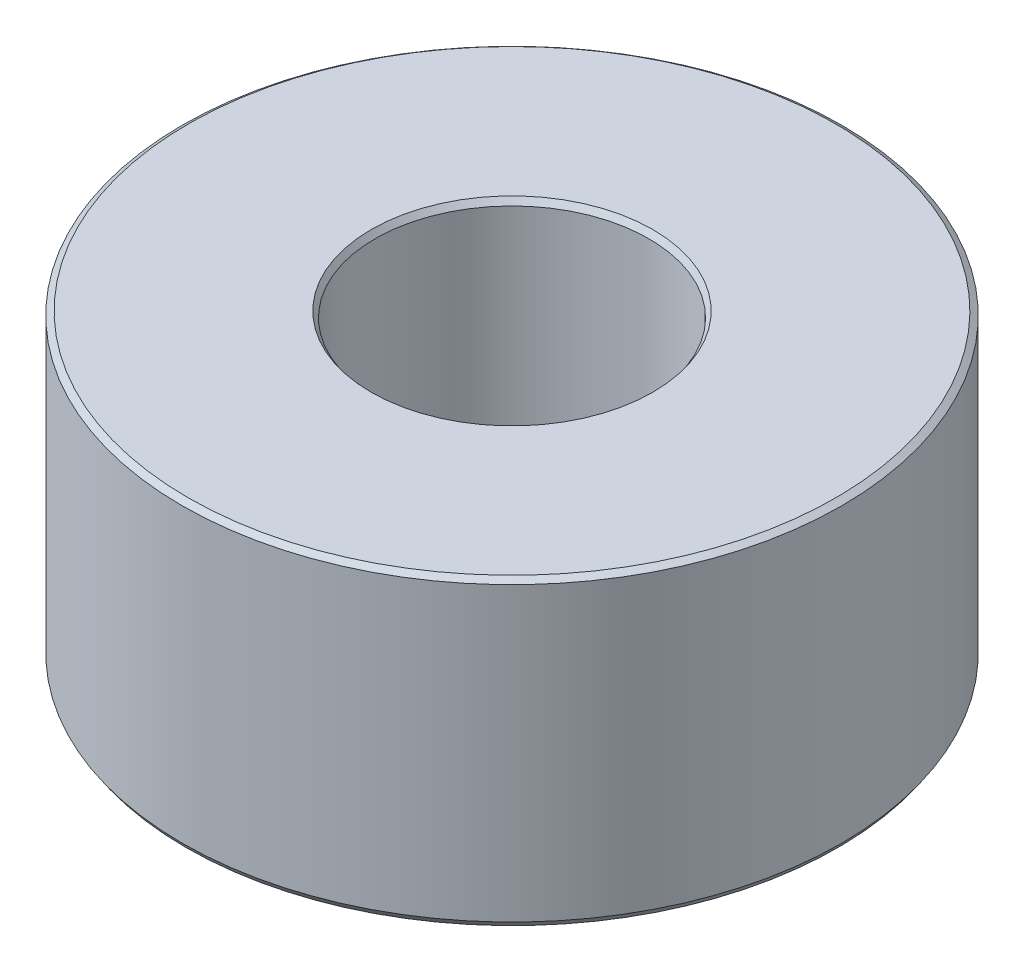
from build123d import *
from OCP.BRepFilletAPI import BRepFilletAPI_MakeChamfer

# Parameters (mm, degrees)
SKETCH1_R           = 60
BOSS_EXTRUDE1_DEPTH = 54.973501313
SKETCH2_R           = 24.912025616
CUT_EXTRUDE1_DEPTH  = 102.104331493
CHAMFER1_SIZE       = 0.724203083
CHAMFER1_SIZE2      = 1.075734862


with BuildPart() as part:
    # Sketch1 → Boss-Extrude1 (new body)
    with BuildSketch(Plane(origin=(0, 0, 0), x_dir=(1, 0, 0), z_dir=(0, 1, 0))):
        Circle(SKETCH1_R)
    extrude(amount=BOSS_EXTRUDE1_DEPTH)

    # Sketch2 → Cut-Extrude1 (cut, through all)
    with BuildSketch(Plane(origin=(0, 0, 0), x_dir=(1, 0, 0), z_dir=(0, 1, 0))):
        Circle(SKETCH2_R)
    extrude(amount=CUT_EXTRUDE1_DEPTH, mode=Mode.SUBTRACT)

    # Chamfer1: one chamfer whose edges measure the first distance from different faces: ONE call of the kernel's chamfer builder (chamfer() names one face for all edges)
    chamfer1_edges_1 = [part.edges().sort_by_distance(p)[0] for p in [
        (-24.912025616, 54.973501313, 0),
    ]]
    chamfer1_side_1 = [part.faces().sort_by_distance(p)[0] for p in [
        (-58.302943725, 54.973501313, 0),
    ]]
    chamfer1_edges_2 = [part.edges().sort_by_distance(p)[0] for p in [
        (-24.912025616, 0, 0),
    ]]
    chamfer1_side_2 = [part.faces().sort_by_distance(p)[0] for p in [
        (-24.912025616, 27.486750656, 0),
    ]]
    chamfer1_edges_3 = [part.edges().sort_by_distance(p)[0] for p in [
        (-60, 0, 0),
    ]]
    chamfer1_side_3 = [part.faces().sort_by_distance(p)[0] for p in [
        (-58.302943725, 0, 0),
    ]]
    chamfer1_edges_4 = [part.edges().sort_by_distance(p)[0] for p in [
        (-60, 54.973501313, 0),
    ]]
    chamfer1_side_4 = [part.faces().sort_by_distance(p)[0] for p in [
        (-60, 27.486750656, 0),
    ]]
    chamfer1 = BRepFilletAPI_MakeChamfer(part.part.solid().wrapped)
    for e in chamfer1_edges_1:
        chamfer1.Add(CHAMFER1_SIZE, CHAMFER1_SIZE2, e.wrapped, chamfer1_side_1[0].wrapped)  # the first distance lies on this face
    for e in chamfer1_edges_2:
        chamfer1.Add(CHAMFER1_SIZE, CHAMFER1_SIZE2, e.wrapped, chamfer1_side_2[0].wrapped)  # the first distance lies on this face
    for e in chamfer1_edges_3:
        chamfer1.Add(CHAMFER1_SIZE, CHAMFER1_SIZE2, e.wrapped, chamfer1_side_3[0].wrapped)  # the first distance lies on this face
    for e in chamfer1_edges_4:
        chamfer1.Add(CHAMFER1_SIZE, CHAMFER1_SIZE2, e.wrapped, chamfer1_side_4[0].wrapped)  # the first distance lies on this face
    add(Compound.cast(chamfer1.Shape()), mode=Mode.REPLACE)


solid = part.part
